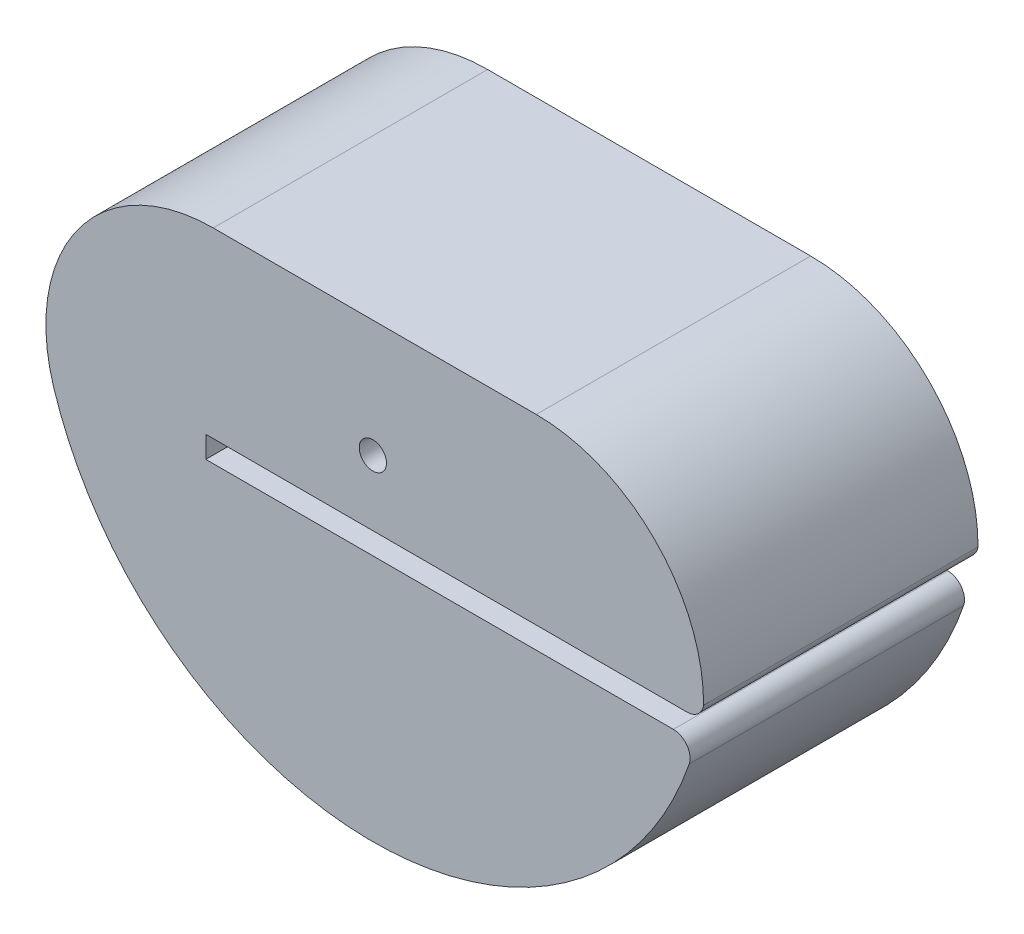
from build123d import *

# Parameters (mm, degrees)
SKETCH1_R           = 50.8
SKETCH1_R_2         = 2.06375
BOSS_EXTRUDE1_DEPTH = 41.656
SKETCH2_W           = 75.184
SKETCH2_H           = 3.302
SKETCH2_W_2         = 95.173769496
SKETCH2_H_2         = 48.323916003
CUT_EXTRUDE6_DEPTH  = 76.2
FILLET1_R           = 2.54
FILLET3_R           = 25.4


with BuildPart() as part:
    # Sketch1 → Boss-Extrude1 (new body)
    with BuildSketch(Plane.XY):
        Circle(SKETCH1_R)
        Circle(SKETCH1_R_2, mode=Mode.SUBTRACT)
    extrude(amount=BOSS_EXTRUDE1_DEPTH)

    # Sketch2 → Cut-Extrude6 (cut)
    with BuildSketch(Plane(origin=(0, 0, 0), x_dir=(-1, 0, 0), z_dir=(0, 0, -1))):
        with Locations((-12.232804706, -11.557)):
            Rectangle(SKETCH2_W, SKETCH2_H)
        with Locations((0, 41.941958002)):
            Rectangle(SKETCH2_W_2, SKETCH2_H_2)
    extrude(amount=-CUT_EXTRUDE6_DEPTH, mode=Mode.SUBTRACT)

    # Fillet1
    fillet1_edges = [part.edges().sort_by_distance(p)[0] for p in [
        (49.052917711, -13.208, 20.828),
        (49.824804706, -9.906, 20.828),
    ]]
    fillet(fillet1_edges, radius=FILLET1_R)

    # Fillet3
    # the kernel refuses this fillet: 25.4 mm, written as the material it takes off along each edge
    with BuildSketch(Plane(origin=(47.586884748, 17.78, -64.168841163), x_dir=(0.1019926357447357, -0.9947851538165624, 0), z_dir=(0, 0, 1))) as fillet3_piece_1:
        with BuildLine():
            CenterArc((22.943972331, -25.253558134), FILLET3_R, 83.844514986, 90.301558127)
            Line((-2.323570576, -22.662945186), (0, 0))
            ThreePointArc((0, 0), (12.833768233, 1.647844473), (25.667536465, 0))
        make_face()
    extrude(amount=169.993682325, mode=Mode.SUBTRACT)
    with BuildSketch(Plane(origin=(-47.586884748, 17.78, -82.578860977), x_dir=(1, 0, 0), z_dir=(0, 0, 1))) as fillet3_piece_2:
        with BuildLine():
            CenterArc((23.356829032, -25.4), FILLET3_R, 90, 107.457603124)
            ThreePointArc((-0.873226684, -33.02), (-3.195360858, -16.437043854), (0, 0))
            Line((0, 0), (23.356829032, 0))
        make_face()
    extrude(amount=206.813721954, mode=Mode.SUBTRACT)


solid = part.part
